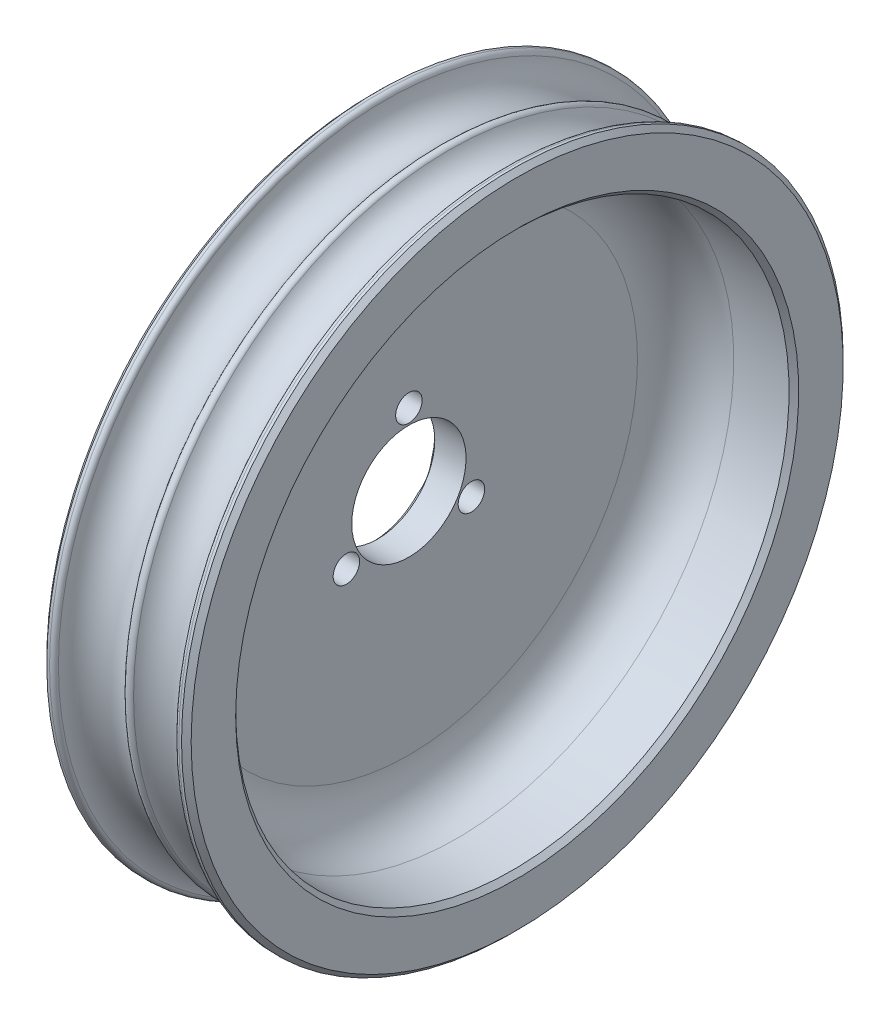
from build123d import *

# Parameters (mm, degrees)
FILLET_1_R      = 0.4
SKETCH_4_R      = 23
SKETCH_4_R_2    = 1.1
SKETCH_4_R_3    = 4.75
EXTRUDE_1_DEPTH = 3
CHAMFER_1_SIZE  = 0.4
FILLET_2_R      = 4


with BuildPart() as part:
    # 草图1 → 旋转1 (revolve)
    with BuildSketch(Plane.XY, mode=Mode.PRIVATE) as revolve_1_sk:
        with BuildLine():
            Line((6, 23), (0, 23))
            Line((0, 23), (-6, 23))
            Line((-6, 23), (-6, 27.5))
            Line((-6, 27.5), (-5, 27.5))
            ThreePointArc((-5, 27.5), (-2.5, 25), (0, 27.5))
            ThreePointArc((0, 27.5), (2.5, 25), (5, 27.5))
            Line((5, 27.5), (6, 27.5))
            Line((6, 27.5), (6, 23))
        make_face()
    revolve(revolve_1_sk.sketch.rotate(Axis((-16.580648815, 0, 0), (1, 0, 0)), 90), axis=Axis((-16.580648815, 0, 0), (1, 0, 0)))

    # 圆角1
    fillet_1_edges = [part.edges().sort_by_distance(p)[0] for p in [
        (0, 0, -27.5),
        (5, 0, -27.5),
        (-5, 0, -27.5),
    ]]
    fillet(fillet_1_edges, radius=FILLET_1_R)

    # 草图4 → 凸台-拉伸1 (add)
    with BuildSketch(Plane.ZY.offset(6)):
        Circle(SKETCH_4_R)
        with Locations((0, 6)):
            Circle(SKETCH_4_R_2, mode=Mode.SUBTRACT)
        with Locations((5.196152423, -3)):
            Circle(SKETCH_4_R_2, mode=Mode.SUBTRACT)
        with Locations((-5.196152423, -3)):
            Circle(SKETCH_4_R_2, mode=Mode.SUBTRACT)
        Circle(SKETCH_4_R_3, mode=Mode.SUBTRACT)
    extrude(amount=-EXTRUDE_1_DEPTH)

    # 倒角1
    # the kernel refuses this chamfer: 0.4 mm, written as the material it takes off along each edge
    with BuildSketch(Plane(origin=(-6, 0, 0), x_dir=(0, 0, 1), z_dir=(0, -1, 0))) as chamfer_1_piece_1:
        Polygon((4.75 + CHAMFER_1_SIZE, 0), (4.75, -CHAMFER_1_SIZE), (4.75, 0), align=None)
    revolve(axis=Axis((-6, 0, 0), (-1, 0, 0)), mode=Mode.SUBTRACT)
    with BuildSketch(Plane(origin=(-6, 6, 0), x_dir=(0, 0, 1), z_dir=(0, -1, 0))) as chamfer_1_piece_2:
        Polygon((1.1 + CHAMFER_1_SIZE, 0), (1.1, -CHAMFER_1_SIZE), (1.1, 0), align=None)
    revolve(axis=Axis((-6, 6, 0), (-1, 0, 0)), mode=Mode.SUBTRACT)
    with BuildSketch(Plane(origin=(-6, -3, 5.196152423), x_dir=(0, 0, 1), z_dir=(0, -1, 0))) as chamfer_1_piece_3:
        Polygon((1.1 + CHAMFER_1_SIZE, 0), (1.1, -CHAMFER_1_SIZE), (1.1, 0), align=None)
    revolve(axis=Axis((-6, -3, 5.196152423), (-1, 0, 0)), mode=Mode.SUBTRACT)
    with BuildSketch(Plane(origin=(-6, -3, -5.196152423), x_dir=(0, 0, 1), z_dir=(0, -1, 0))) as chamfer_1_piece_4:
        Polygon((1.1 + CHAMFER_1_SIZE, 0), (1.1, -CHAMFER_1_SIZE), (1.1, 0), align=None)
    revolve(axis=Axis((-6, -3, -5.196152423), (-1, 0, 0)), mode=Mode.SUBTRACT)
    with BuildSketch(Plane(origin=(6, 0, 0), x_dir=(0, 0, 1), z_dir=(0, 1, 0))) as chamfer_1_piece_5:
        Polygon((27.5, -CHAMFER_1_SIZE), (27.5 - CHAMFER_1_SIZE, 0), (27.5, 0), align=None)
    revolve(axis=Axis((6, 0, 0), (1, 0, 0)), mode=Mode.SUBTRACT)
    with BuildSketch(Plane(origin=(6, 0, 0), x_dir=(0, 0, 1), z_dir=(0, 1, 0))) as chamfer_1_piece_6:
        Polygon((23, -CHAMFER_1_SIZE), (23 + CHAMFER_1_SIZE, 0), (23, 0), align=None)
    revolve(axis=Axis((6, 0, 0), (1, 0, 0)), mode=Mode.SUBTRACT)
    with BuildSketch(Plane(origin=(-6, 0, 0), x_dir=(0, 0, 1), z_dir=(0, 1, 0))) as chamfer_1_piece_7:
        Polygon((27.5, CHAMFER_1_SIZE), (27.5 - CHAMFER_1_SIZE, 0), (27.5, 0), align=None)
    revolve(axis=Axis((-6, 0, 0), (1, 0, 0)), mode=Mode.SUBTRACT)

    # 圆角2
    fillet_2_edges = [part.edges().sort_by_distance(p)[0] for p in [
        (-3, 0, -23),
    ]]
    fillet(fillet_2_edges, radius=FILLET_2_R)


solid = part.part
